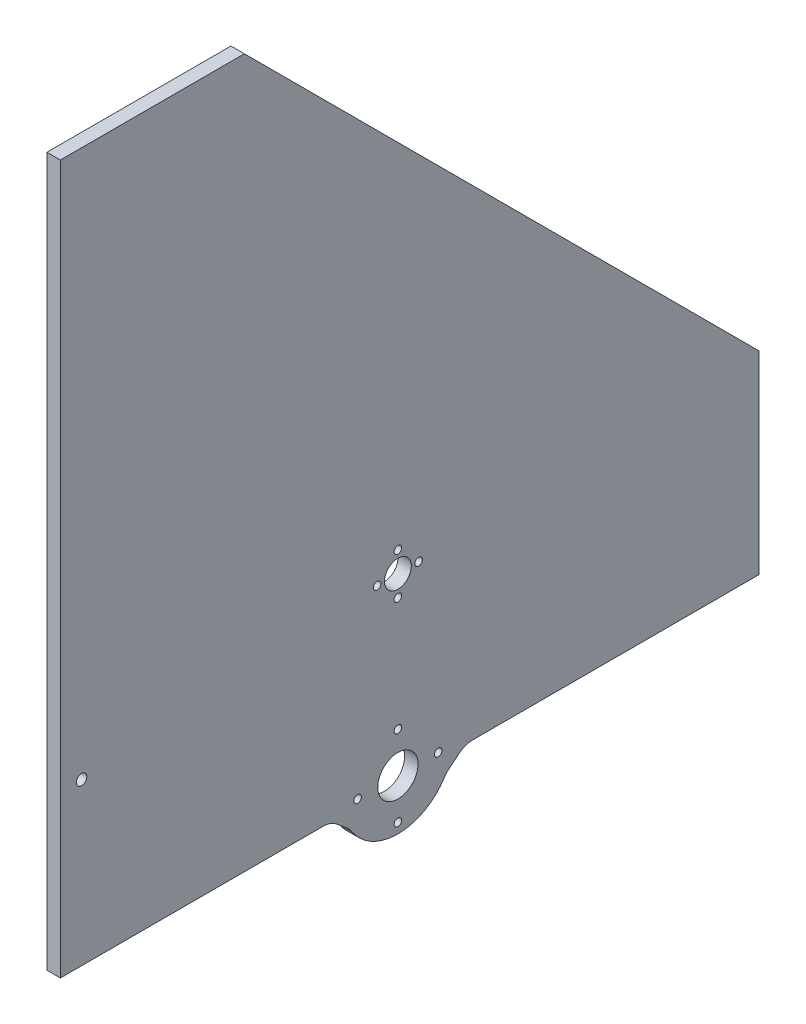
from build123d import *

# Parameters (mm, degrees)
MAIN_PLATE_SIZE_DEPTH                         = 6.35
SKETCH2_R                                     = 9.525
SKETCH2_R_2                                   = 1.778
BOTTOM_SHAFT_MOUNTING_HOLES_DEPTH             = 486.307863629
SKETCH3_R                                     = 6.35
SKETCH3_R_2                                   = 1.778
TOP_BATTERY_BOX_MOUNTING_HOLES_DEPTH          = 486.307863629
THIS_IS_TO_MATCH_THE_IDIOTIC_DESIGN_OF_B_SIZE = 6.35
THIS_IS_TO_MATCH_THE_IDIOTIC_DESIGN_2_R       = 10
SKETCH4_R                                     = 2.5
F_20MM_EXTRUSION_MOUNT_DEPTH                  = 486.307863629


with BuildPart() as part:
    # Sketch1 → Main Plate Size (new body)
    with BuildSketch(Plane(origin=(0, 0, 0), x_dir=(0, 0, -1), z_dir=(1, 0, 0))):
        Polygon((330.2, 112.361360549), (86.961360549, 355.6), (0, 355.6), (0, 0), (330.2, 0), align=None)
    extrude(amount=MAIN_PLATE_SIZE_DEPTH)

    # Sketch2 → Bottom Shaft Mounting Holes (cut, through all)
    with BuildSketch(Plane(origin=(6.35, 0, 0), x_dir=(0, 0, -1), z_dir=(1, 0, 0))):
        with BuildLine():
            Line((134.1120127, 20.8026), (0, 20.8026))
            Line((0, 20.8026), (0, 0))
            Line((0, 0), (159.512000023, 0))
            ThreePointArc((159.512000023, 0), (143.096249024, 5.864358018), (134.1120127, 20.8026))
        make_face()
        with BuildLine():
            ThreePointArc((184.9119873, 20.8026), (175.927750994, 5.864358033), (159.512000023, 0))
            Line((159.512000023, 0), (177.8, 0))
            Line((177.8, 0), (330.2, 0))
            Line((330.2, 0), (330.2, 20.8026))
            Line((330.2, 20.8026), (184.9119873, 20.8026))
        make_face()
        with Locations((159.512, 23.8252)):
            Circle(SKETCH2_R)
        with Locations((159.512, 4.7752)):
            Circle(SKETCH2_R_2)
        with Locations((178.562, 23.8252)):
            Circle(SKETCH2_R_2)
        with Locations((159.512, 42.8752)):
            Circle(SKETCH2_R_2)
        with Locations((140.462, 23.8252)):
            Circle(SKETCH2_R_2)
    extrude(amount=-BOTTOM_SHAFT_MOUNTING_HOLES_DEPTH, mode=Mode.SUBTRACT)

    # Sketch3 → Top Battery Box Mounting Holes (cut, through all)
    with BuildSketch(Plane(origin=(6.35, 0, 0), x_dir=(0, 0, -1), z_dir=(1, 0, 0))):
        with Locations((159.512, 106.5022)):
            Circle(SKETCH3_R)
        with Locations((149.733, 106.5022)):
            Circle(SKETCH3_R_2)
        with Locations((159.512, 116.2812)):
            Circle(SKETCH3_R_2)
        with Locations((169.291, 106.5022)):
            Circle(SKETCH3_R_2)
        with Locations((159.512, 96.7232)):
            Circle(SKETCH3_R_2)
    extrude(amount=-TOP_BATTERY_BOX_MOUNTING_HOLES_DEPTH, mode=Mode.SUBTRACT)

    # This is to match the idiotic Design of B
    # the kernel refuses this chamfer: 6.35 mm, written as the material it adds along each edge
    with BuildSketch(Plane(origin=(6.35, 20.8026, -134.1120127), x_dir=(0, -0.9387383646661523, -0.34463064678568256), z_dir=(-1, 0, 0))) as this_is_to_match_the_idiotic_design_of_b_piece_1:
        with BuildLine():
            Line((7.921958409, 0), (-THIS_IS_TO_MATCH_THE_IDIOTIC_DESIGN_OF_B_SIZE * 0.344630646786, THIS_IS_TO_MATCH_THE_IDIOTIC_DESIGN_OF_B_SIZE * 0.938738364666))
            Line((-THIS_IS_TO_MATCH_THE_IDIOTIC_DESIGN_OF_B_SIZE * 0.344630646786, THIS_IS_TO_MATCH_THE_IDIOTIC_DESIGN_OF_B_SIZE * 0.938738364666), (0, 0))
            ThreePointArc((0, 0), (4.071959946, 0.304342453), (7.921958409, 0))
        make_face()
    extrude(amount=6.35)
    with BuildSketch(Plane(origin=(6.35, 20.8026, -184.9119873), x_dir=(0, 0, -1), z_dir=(-1, 0, 0))) as this_is_to_match_the_idiotic_design_of_b_piece_2:
        with BuildLine():
            Line((THIS_IS_TO_MATCH_THE_IDIOTIC_DESIGN_OF_B_SIZE, 0), (-2.73014965, 7.436646282))
            ThreePointArc((-2.73014965, 7.436646282), (-1.117624253, 3.927390757), (0, 0))
            Line((0, 0), (THIS_IS_TO_MATCH_THE_IDIOTIC_DESIGN_OF_B_SIZE, 0))
        make_face()
    extrude(amount=6.35)

    # This is to match the idiotic Design  2
    this_is_to_match_the_idiotic_design_2_edges = [part.edges().sort_by_distance(p)[0] for p in [
        (3.175, 13.365953718, -136.84216235),
        (3.175, 13.365953718, -182.18183765),
        (3.175, 20.8026, -191.2619873),
        (3.175, 20.8026, -127.7620127),
    ]]
    fillet(this_is_to_match_the_idiotic_design_2_edges, radius=THIS_IS_TO_MATCH_THE_IDIOTIC_DESIGN_2_R)

    # Sketch4 → 20mm Extrusion Mount (cut, through all)
    with BuildSketch(Plane(origin=(6.35, 0, 0), x_dir=(0, 0, -1), z_dir=(1, 0, 0))):
        with Locations((10, 97.0026)):
            Circle(SKETCH4_R)
    extrude(amount=-F_20MM_EXTRUSION_MOUNT_DEPTH, mode=Mode.SUBTRACT)


solid = part.part
